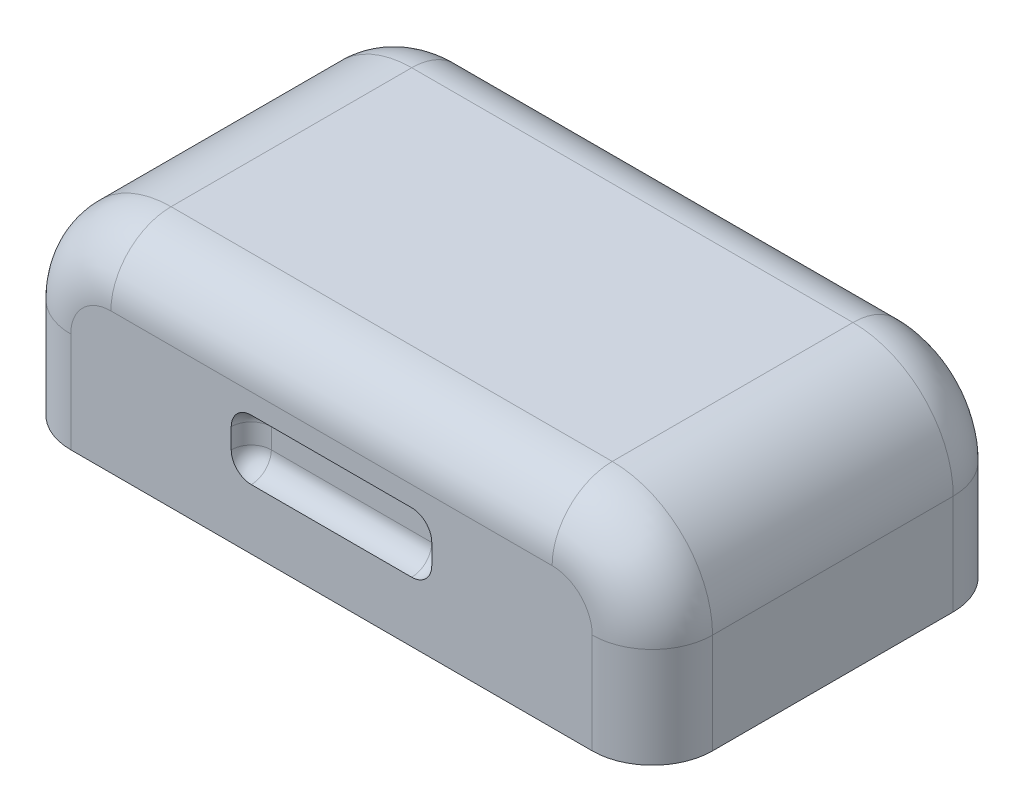
from build123d import *

# Parameters (mm, degrees)
ESQUISSE1_W             = 160
ESQUISSE1_H             = 90
EXTRUSION1_DEPTH        = 50
CONG_1_R                = 25
CONG_2_R                = 15
COQUE1_T                = -7
ESQUISSE2_W             = 50
ESQUISSE2_H             = 15
ENL_V_MAT_EXTRU_1_DEPTH = 5
CONG_4_R                = 5
CONG_5_R                = 5
CONG_6_R                = 5
CONG_7_R                = 5
CONG_4_OF_SYM_TRIE1_R   = 5
CONG_5_OF_SYM_TRIE1_R   = 5
CONG_6_OF_SYM_TRIE1_R   = 5
CONG_7_OF_SYM_TRIE1_R   = 5
ECHELLE1_SCALE          = 1.125


with BuildPart() as part:
    # Esquisse1 → Extrusion1 (new body)
    with BuildSketch(Plane(origin=(0, 0, 0), x_dir=(1, 0, 0), z_dir=(0, 1, 0))):
        with Locations((35.341232877, 23.705753425)):
            Rectangle(ESQUISSE1_W, ESQUISSE1_H)
    extrude(amount=EXTRUSION1_DEPTH)

    # Congé1
    cong_1_edges = [part.edges().sort_by_distance(p)[0] for p in [
        (115.341232877, 50, -23.705753425),
        (-44.658767123, 50, -23.705753425),
    ]]
    fillet(cong_1_edges, radius=CONG_1_R)

    # Congé2
    cong_2_edges = [part.edges().sort_by_distance(p)[0] for p in [
        (35.341232877, 50, 21.294246575),
        (35.341232877, 50, -68.705753425),
        (115.341232877, 12.5, 21.294246575),
        (-44.658767123, 12.5, 21.294246575),
        (108.018902406, 42.67766953, 21.294246575),
        (-37.336436653, 42.67766953, 21.294246575),
        (-44.658767123, 12.5, -68.705753425),
        (115.341232877, 12.5, -68.705753425),
        (108.018902406, 42.67766953, -68.705753425),
        (-37.336436653, 42.67766953, -68.705753425),
    ]]
    fillet(cong_2_edges, radius=CONG_2_R)

    # Coque1
    coque1_openings = [part.faces().sort_by_distance(p)[0] for p in [
        (35.341232877, 0, -23.705753425),
    ]]
    offset(amount=COQUE1_T, openings=coque1_openings, kind=Kind.INTERSECTION)

    # Esquisse2 → Enlèv. mat.-Extru.1 (cut)
    with BuildSketch(Plane.XY.offset(21.294246575)):
        with Locations((35.341232877, 22.5)):
            Rectangle(ESQUISSE2_W, ESQUISSE2_H)
    enl_v_mat_extru_1 = extrude(amount=-ENL_V_MAT_EXTRU_1_DEPTH, mode=Mode.SUBTRACT)

    # Congé4
    cong_4_edges = [part.edges().sort_by_distance(p)[0] for p in [
        (35.341232877, 15, 16.294246575),
    ]]
    fillet(cong_4_edges, radius=CONG_4_R - 0.0001)  # a hair under: the kernel refuses the full size

    # Congé5
    cong_5_edges = [part.edges().sort_by_distance(p)[0] for p in [
        (35.341232877, 30, 16.294246575),
    ]]
    fillet(cong_5_edges, radius=CONG_5_R - 0.0001)  # a hair under: the kernel refuses the full size

    # Congé6
    cong_6_edges = [part.edges().sort_by_distance(p)[0] for p in [
        (10.341232877, 16.464436805, 17.75868338),
        (10.341232877, 22.5, 16.294246575),
        (10.341232877, 28.535563195, 17.75868338),
    ]]
    fillet(cong_6_edges, radius=CONG_6_R - 0.0001)  # a hair under: the kernel refuses the full size

    # Congé7
    cong_7_edges = [part.edges().sort_by_distance(p)[0] for p in [
        (60.341232877, 22.5, 16.294246575),
        (60.341232877, 16.464436805, 17.75868338),
        (60.341232877, 28.535563195, 17.75868338),
    ]]
    fillet(cong_7_edges, radius=CONG_7_R - 0.0001)  # a hair under: the kernel refuses the full size

    # Symétrie1: Enlèv. mat.-Extru.1 across plane
    add(enl_v_mat_extru_1.mirror(Plane.XY.offset(-23.705753425)), mode=Mode.SUBTRACT)

    # Congé4 of Symétrie1
    cong_4_of_sym_trie1_edges = [part.edges().sort_by_distance(p)[0] for p in [
        (35.341232877, 15, -63.705753425),
    ]]
    fillet(cong_4_of_sym_trie1_edges, radius=CONG_4_OF_SYM_TRIE1_R - 0.0001)  # a hair under: the kernel refuses the full size

    # Congé5 of Symétrie1
    cong_5_of_sym_trie1_edges = [part.edges().sort_by_distance(p)[0] for p in [
        (35.341232877, 30, -63.705753425),
    ]]
    fillet(cong_5_of_sym_trie1_edges, radius=CONG_5_OF_SYM_TRIE1_R - 0.0001)  # a hair under: the kernel refuses the full size

    # Congé6 of Symétrie1
    cong_6_of_sym_trie1_edges = [part.edges().sort_by_distance(p)[0] for p in [
        (10.341232877, 16.464436805, -65.170190229),
        (10.341232877, 22.5, -63.705753425),
        (10.341232877, 28.535563195, -65.170190229),
    ]]
    fillet(cong_6_of_sym_trie1_edges, radius=CONG_6_OF_SYM_TRIE1_R - 0.0001)  # a hair under: the kernel refuses the full size

    # Congé7 of Symétrie1
    cong_7_of_sym_trie1_edges = [part.edges().sort_by_distance(p)[0] for p in [
        (60.341232877, 22.5, -63.705753425),
        (60.341232877, 16.464436805, -65.170190229),
        (60.341232877, 28.535563195, -65.170190229),
    ]]
    fillet(cong_7_of_sym_trie1_edges, radius=CONG_7_OF_SYM_TRIE1_R - 0.0001)  # a hair under: the kernel refuses the full size


with BuildPart() as part_1:
    # Echelle1: scaled about (35.341232877, 30.549354713, -23.705753425)
    add(part.part.scale(ECHELLE1_SCALE).moved(Location((-4.41765411, -3.818669339, 2.963219178))))


solid = part_1.part
